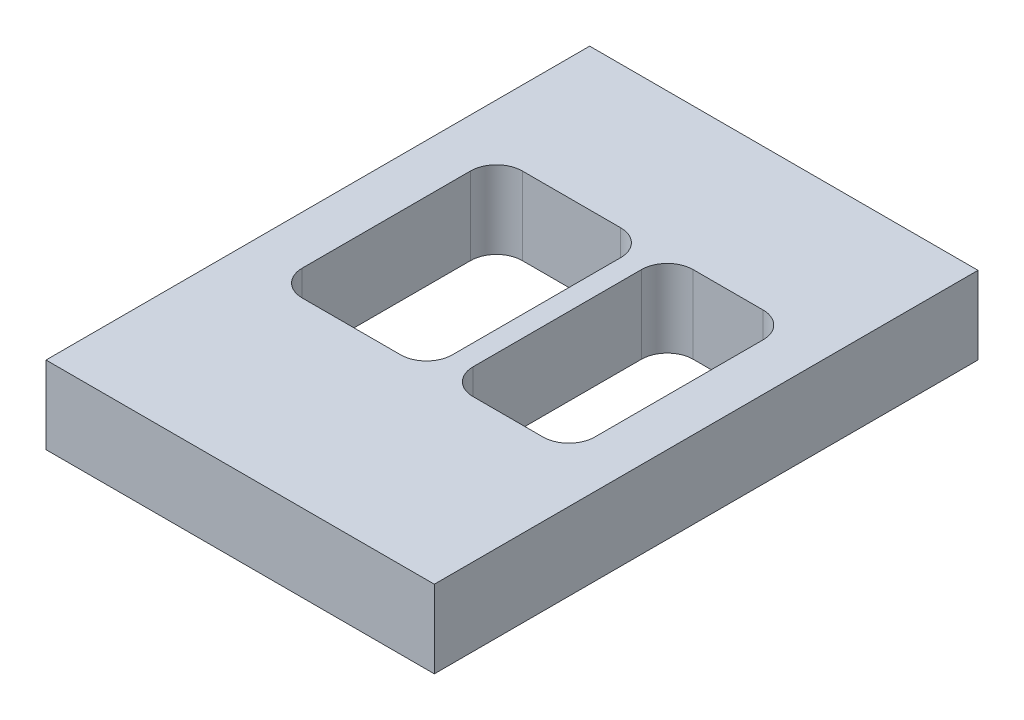
from build123d import *

# Parameters (mm, degrees)
SKETCH1_W           = 150
SKETCH1_H           = 210
BOSS_EXTRUDE1_DEPTH = 30
CUT_EXTRUDE1_REACH  = 134.476
SKETCH3_W           = 58
SKETCH3_H           = 85
SKETCH3_W_2         = 47
FILLET1_R           = 10


with BuildPart() as part:
    # Sketch1 → Boss-Extrude1 (new body)
    with BuildSketch(Plane(origin=(0, 0, 0), x_dir=(1, 0, 0), z_dir=(0, 1, 0))):
        Rectangle(SKETCH1_W, SKETCH1_H)
    extrude(amount=-BOSS_EXTRUDE1_DEPTH)

    # Sketch3 → Cut-Extrude1 (cut, up to next)
    with BuildSketch(Plane(origin=(0, 0, 0), x_dir=(1, 0, 0), z_dir=(0, 1, 0)), mode=Mode.PRIVATE) as cut_extrude1_sk1:
        with Locations((-27.25, 7.73)):
            Rectangle(SKETCH3_W, SKETCH3_H)
    cut_extrude1_tool1 = extrude(cut_extrude1_sk1.sketch, amount=-CUT_EXTRUDE1_REACH, mode=Mode.PRIVATE) & part.part
    # Sketch3 → Cut-Extrude1 (cut, up to next)
    with BuildSketch(Plane(origin=(0, 0, 0), x_dir=(1, 0, 0), z_dir=(0, 1, 0)), mode=Mode.PRIVATE) as cut_extrude1_sk2:
        with Locations((33.25, 7.73)):
            Rectangle(SKETCH3_W_2, SKETCH3_H)
    cut_extrude1_tool2 = extrude(cut_extrude1_sk2.sketch, amount=-CUT_EXTRUDE1_REACH, mode=Mode.PRIVATE) & part.part
    add(cut_extrude1_tool1.solids().sort_by_distance((-27.25, 0, -7.73))[0], mode=Mode.SUBTRACT)
    add(cut_extrude1_tool2.solids().sort_by_distance((33.25, 0, -7.73))[0], mode=Mode.SUBTRACT)

    # Fillet1
    fillet1_edges = [part.edges().sort_by_distance(p)[0] for p in [
        (9.75, -15, -50.23),
        (56.75, -15, 34.77),
        (56.75, -15, -50.23),
        (9.75, -15, 34.77),
        (-56.25, -15, 34.77),
        (1.75, -15, 34.77),
        (1.75, -15, -50.23),
        (-56.25, -15, -50.23),
    ]]
    fillet(fillet1_edges, radius=FILLET1_R)


solid = part.part
